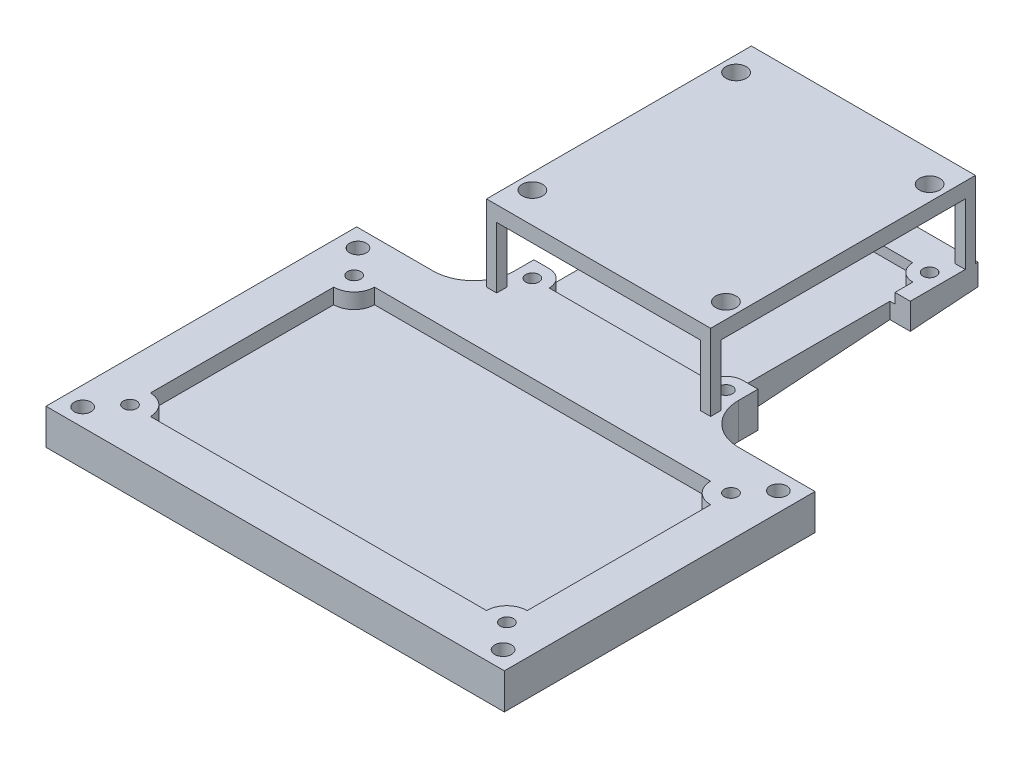
from build123d import *

# Parameters (mm, degrees)
SKETCH1_R           = 1.65
BOSS_EXTRUDE1_DEPTH = 7
CHAMFER1_SIZE       = 40
CHAMFER1_SIZE2      = 2.797072478
SKETCH2_R           = 1.3
CUT_EXTRUDE1_DEPTH  = 147.986393928
SKETCH3_R           = 1.3
CUT_EXTRUDE2_DEPTH  = 147.986393928
CUT_EXTRUDE3_DEPTH  = 3
CUT_EXTRUDE4_DEPTH  = 2
SKETCH6_W           = 4
SKETCH6_H           = 29.9
CUT_EXTRUDE5_DEPTH  = 147.986393928
SKETCH7_W           = 44
SKETCH7_H           = 52
SKETCH7_R           = 2
BOSS_EXTRUDE2_DEPTH = 15
SKETCH8_W           = 48
SKETCH8_H           = 12
CUT_EXTRUDE6_DEPTH  = 136.753452995
SKETCH9_W           = 40
SKETCH9_H           = 12
CUT_EXTRUDE7_DEPTH  = 149.068396358


with BuildPart() as part:
    # Sketch1 → Boss-Extrude1 (new body)
    with BuildSketch(Plane(origin=(0, 0, 0), x_dir=(1, 0, 0), z_dir=(0, 1, 0))):
        with BuildLine():
            Line((0, 0), (90, 0))
            Line((90, 0), (90, 61))
            Line((90, 61), (75, 61))
            ThreePointArc((75, 61), (69.343145751, 63.343145751), (67, 69))
            Line((67, 69), (67, 116))
            Line((67, 116), (23, 116))
            Line((23, 116), (23, 69))
            ThreePointArc((23, 69), (20.656854249, 63.343145751), (15, 61))
            Line((15, 61), (0, 61))
            Line((0, 61), (0, 0))
        make_face()
        with Locations((3.725, 57.525)):
            Circle(SKETCH1_R, mode=Mode.SUBTRACT)
        with Locations((86.275, 57.525)):
            Circle(SKETCH1_R, mode=Mode.SUBTRACT)
        with Locations((86.275, 3.475)):
            Circle(SKETCH1_R, mode=Mode.SUBTRACT)
        with Locations((3.725, 3.475)):
            Circle(SKETCH1_R, mode=Mode.SUBTRACT)
    extrude(amount=BOSS_EXTRUDE1_DEPTH)

    # Chamfer1
    chamfer1_edges = [part.edges().sort_by_distance(p)[0] for p in [
        (45, 0, -116),
    ]]
    chamfer1_side = [part.faces().sort_by_distance(p)[0] for p in [
        (45, 0, -48.371984874),
    ]]
    chamfer(chamfer1_edges, length=CHAMFER1_SIZE, length2=CHAMFER1_SIZE2, reference=chamfer1_side[0])

    # Sketch2 → Cut-Extrude1 (cut, through all)
    with BuildSketch(Plane(origin=(0, 7, 0), x_dir=(1, 0, 0), z_dir=(0, 1, 0))):
        with Locations((8, 52.5)):
            Circle(SKETCH2_R)
        with Locations((8, 8.5)):
            Circle(SKETCH2_R)
        with Locations((82, 52.5)):
            Circle(SKETCH2_R)
        with Locations((82, 8.5)):
            Circle(SKETCH2_R)
    extrude(amount=-CUT_EXTRUDE1_DEPTH, mode=Mode.SUBTRACT)

    # Sketch3 → Cut-Extrude2 (cut, through all)
    with BuildSketch(Plane(origin=(0, 7, 0), x_dir=(1, 0, 0), z_dir=(0, 1, 0))):
        with Locations((26, 109.5)):
            Circle(SKETCH3_R)
        with Locations((64, 109.5)):
            Circle(SKETCH3_R)
        with Locations((26, 69.5)):
            Circle(SKETCH3_R)
        with Locations((64, 69.5)):
            Circle(SKETCH3_R)
    extrude(amount=-CUT_EXTRUDE2_DEPTH, mode=Mode.SUBTRACT)

    # Sketch4 → Cut-Extrude3 (cut)
    with BuildSketch(Plane(origin=(0, 7, 0), x_dir=(1, 0, 0), z_dir=(0, 1, 0))):
        with BuildLine():
            Line((12, 52.5), (78, 52.5))
            ThreePointArc((78, 52.5), (79.171572875, 49.671572875), (82, 48.5))
            Line((82, 48.5), (82, 12.5))
            ThreePointArc((82, 12.5), (79.171572875, 11.328427125), (78, 8.5))
            Line((78, 8.5), (12, 8.5))
            ThreePointArc((12, 8.5), (10.828427125, 11.328427125), (8, 12.5))
            Line((8, 12.5), (8, 48.5))
            ThreePointArc((8, 48.5), (10.828427125, 49.671572875), (12, 52.5))
        make_face()
    extrude(amount=-CUT_EXTRUDE3_DEPTH, mode=Mode.SUBTRACT)

    # Sketch5 → Cut-Extrude4 (cut)
    with BuildSketch(Plane(origin=(0, 7, 0), x_dir=(1, 0, 0), z_dir=(0, 1, 0))):
        with BuildLine():
            Line((29.3, 109.5), (60.7, 109.5))
            ThreePointArc((60.7, 109.5), (61.666547622, 107.166547622), (64, 106.2))
            Line((64, 106.2), (64, 72.8))
            ThreePointArc((64, 72.8), (61.666547622, 71.833452378), (60.7, 69.5))
            Line((60.7, 69.5), (29.3, 69.5))
            ThreePointArc((29.3, 69.5), (28.333452378, 71.833452378), (26, 72.8))
            Line((26, 72.8), (26, 106.2))
            ThreePointArc((26, 106.2), (28.333452378, 107.166547622), (29.3, 109.5))
        make_face()
    extrude(amount=-CUT_EXTRUDE4_DEPTH, mode=Mode.SUBTRACT)

    # Sketch6 → Cut-Extrude5 (cut, through all)
    with BuildSketch(Plane(origin=(0, 7, 0), x_dir=(1, 0, 0), z_dir=(0, 1, 0))):
        with Locations((25, 87.75)):
            Rectangle(SKETCH6_W, SKETCH6_H)
        with Locations((65, 87.75)):
            Rectangle(SKETCH6_W, SKETCH6_H)
    extrude(amount=-CUT_EXTRUDE5_DEPTH, mode=Mode.SUBTRACT)

    # Sketch7 → Boss-Extrude2 (add)
    with BuildSketch(Plane(origin=(0, 7, 0), x_dir=(1, 0, 0), z_dir=(0, 1, 0))):
        with Locations((45, 89.5)):
            Rectangle(SKETCH7_W, SKETCH7_H)
        with Locations((26, 109.5)):
            Circle(SKETCH7_R, mode=Mode.SUBTRACT)
        with Locations((64, 109.5)):
            Circle(SKETCH7_R, mode=Mode.SUBTRACT)
        with Locations((64, 69.5)):
            Circle(SKETCH7_R, mode=Mode.SUBTRACT)
        with Locations((26, 69.5)):
            Circle(SKETCH7_R, mode=Mode.SUBTRACT)
    extrude(amount=BOSS_EXTRUDE2_DEPTH)

    # Sketch8 → Cut-Extrude6 (cut, through all)
    with BuildSketch(Plane(origin=(67, 0, 0), x_dir=(0, 0, -1), z_dir=(1, 0, 0))):
        with Locations((89.5, 13)):
            Rectangle(SKETCH8_W, SKETCH8_H)
    extrude(amount=-CUT_EXTRUDE6_DEPTH, mode=Mode.SUBTRACT)

    # Sketch9 → Cut-Extrude7 (cut, through all)
    with BuildSketch(Plane(origin=(0, 0, -115.5), x_dir=(-1, 0, 0), z_dir=(0, 0, -1))):
        with Locations((-45, 13)):
            Rectangle(SKETCH9_W, SKETCH9_H)
    extrude(amount=-CUT_EXTRUDE7_DEPTH, mode=Mode.SUBTRACT)


solid = part.part
